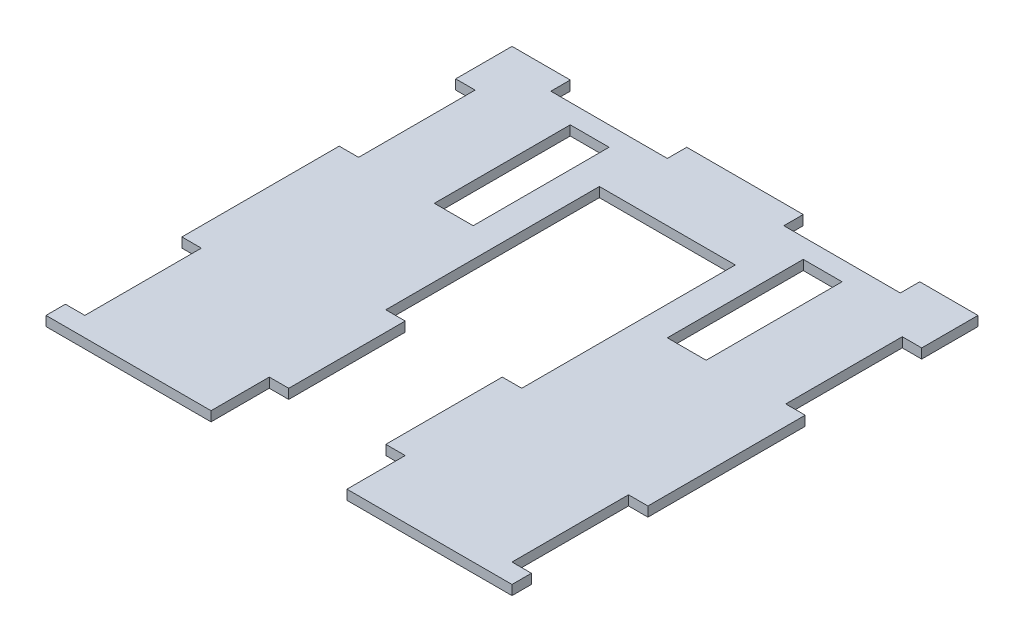
from build123d import *

# Parameters (mm, degrees)
BOSS_EXTRUDE1_DEPTH = 6.35
SKETCH2_W           = 12.7
SKETCH2_H           = 76.2
SKETCH2_W_2         = 76.2
SKETCH2_H_2         = 12.7
SKETCH2_W_3         = 25.4
SKETCH2_H_3         = 88.9
CUT_EXTRUDE1_DEPTH  = 319.324429631
SKETCH3_W           = 12.7
SKETCH3_H           = 76.2
BOSS_EXTRUDE2_DEPTH = 6.35


with BuildPart() as part:
    # Sketch1 → Boss-Extrude1 (new body)
    with BuildSketch(Plane(origin=(0, 0, 0), x_dir=(1, 0, 0), z_dir=(0, 1, 0))):
        Polygon((-152.4, 25.4), (-152.4, -279.4), (-44.45, -279.4), (-44.45, -25.4), (44.45, -25.4), (44.45, -279.4), (152.4, -279.4), (152.4, 25.4), align=None)
    extrude(amount=BOSS_EXTRUDE1_DEPTH)

    # Sketch2 → Cut-Extrude1 (cut, through all)
    with BuildSketch(Plane(origin=(0, 6.35, 0), x_dir=(1, 0, 0), z_dir=(0, 1, 0))):
        with Locations((146.05, -49.53)):
            Rectangle(SKETCH2_W, SKETCH2_H)
        with Locations((146.05, -228.6)):
            Rectangle(SKETCH2_W, SKETCH2_H)
        with Locations((-146.05, -228.6)):
            Rectangle(SKETCH2_W, SKETCH2_H)
        with Locations((-146.05, -49.53)):
            Rectangle(SKETCH2_W, SKETCH2_H)
        with Locations((-76.2, 19.05)):
            Rectangle(SKETCH2_W_2, SKETCH2_H_2)
        with Locations((76.2, 19.05)):
            Rectangle(SKETCH2_W_2, SKETCH2_H_2)
        with Locations((-76.2, -44.45)):
            Rectangle(SKETCH2_W_3, SKETCH2_H_3)
        with Locations((76.2, -44.45)):
            Rectangle(SKETCH2_W_3, SKETCH2_H_3)
    extrude(amount=-CUT_EXTRUDE1_DEPTH, mode=Mode.SUBTRACT)

    # Sketch3 → Boss-Extrude2 (add)
    with BuildSketch(Plane(origin=(0, 6.35, 0), x_dir=(1, 0, 0), z_dir=(0, 1, 0))):
        with Locations((38.1, -203.2)):
            Rectangle(SKETCH3_W, SKETCH3_H)
        with Locations((-38.1, -203.2)):
            Rectangle(SKETCH3_W, SKETCH3_H)
    extrude(amount=-BOSS_EXTRUDE2_DEPTH)


solid = part.part
